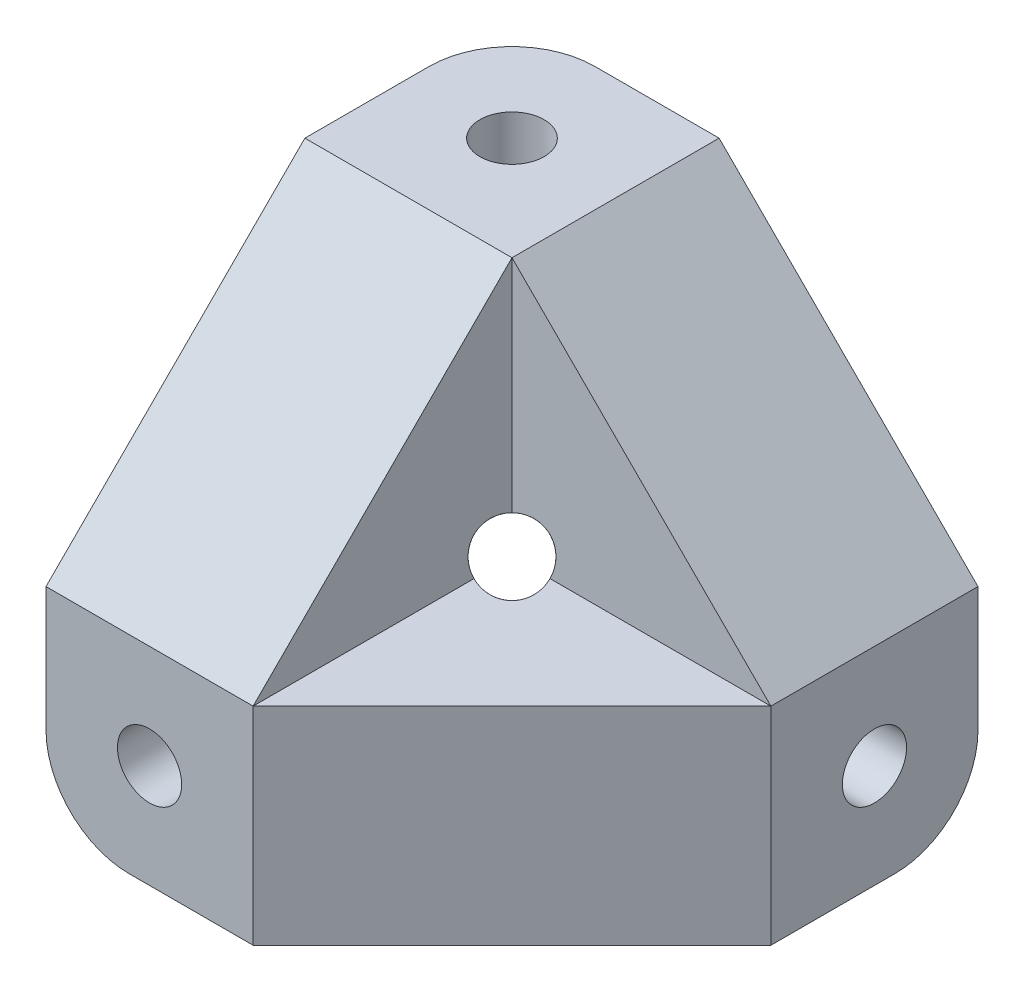
from build123d import *

# Parameters (mm, degrees)
ESBO_O1_W                        = 45
ESBO_O1_H                        = 45
RESSALTO_EXTRUS_O1_DEPTH         = 20
ESBO_O2_W                        = 25
ESBO_O2_H                        = 25
CORTE_EXTRUS_O1_DEPTH            = 70.705238631
ESBO_O3_W                        = 20
ESBO_O3_H                        = 20
RESSALTO_EXTRUS_O2_DEPTH         = 25
FURO_DE_DI_METRO_6_2_6_2_1_D     = 6.2
FURO_DE_DI_METRO_6_2_6_2_1_DEPTH = 35
FURO_DE_DI_METRO_6_2_6_2_2_D     = 6.2
FURO_DE_DI_METRO_6_2_6_2_2_DEPTH = 35
FURO_DE_DI_METRO_6_2_6_2_3_D     = 6.2
FURO_DE_DI_METRO_6_2_6_2_3_DEPTH = 35
FILETE2_R                        = 8
CHANFRO1_SIZE                    = 25
CHANFRO2_SIZE                    = 25
RESSALTO_EXTRUS_O3_DEPTH         = 20
ESBO_O12_R                       = 3
CORTE_EXTRUS_O2_DEPTH            = 71.906960985


# Some blends are built 0.0001 mm under size
with BuildPart() as part:
    # Esboço1 → Ressalto-extrusão1 (new body)
    with BuildSketch(Plane.XY.offset(20)):
        with Locations((-12.862035225, 34.142270059)):
            Rectangle(ESBO_O1_W, ESBO_O1_H)
    extrude(amount=-RESSALTO_EXTRUS_O1_DEPTH)

    # Esboço2 → Corte-extrusão1 (cut, through all)
    with BuildSketch(Plane(origin=(0, 0, 0), x_dir=(-1, 0, 0), z_dir=(0, 0, -1))):
        with Locations((2.862035225, 44.142270059)):
            Rectangle(ESBO_O2_W, ESBO_O2_H)
    extrude(amount=-CORTE_EXTRUS_O1_DEPTH, mode=Mode.SUBTRACT)

    # Esboço3 → Ressalto-extrusão2 (add)
    with BuildSketch(Plane.XY.offset(20)):
        with Locations((-25.362035225, 21.642270059)):
            Rectangle(ESBO_O3_W, ESBO_O3_H)
    extrude(amount=RESSALTO_EXTRUS_O2_DEPTH)

    # Furo de diâmetro Ø6.2 (6.2)1
    with Locations(Plane(origin=(9.637964775, 0, 0), x_dir=(0, 0, -1), z_dir=(1, 0, 0))):
        with Locations((-10, 21.642270059)):
            Hole(FURO_DE_DI_METRO_6_2_6_2_1_D / 2, depth=FURO_DE_DI_METRO_6_2_6_2_1_DEPTH)

    # Furo de diâmetro Ø6.2 (6.2)2
    with Locations(Plane(origin=(0, 56.642270059, 0), x_dir=(1, 0, 0), z_dir=(0, 1, 0))):
        with Locations((-25.362035225, -10)):
            Hole(FURO_DE_DI_METRO_6_2_6_2_2_D / 2, depth=FURO_DE_DI_METRO_6_2_6_2_2_DEPTH)

    # Furo de diâmetro Ø6.2 (6.2)3
    with Locations(Plane.XY.offset(45)):
        with Locations((-25.362035225, 21.642270059)):
            Hole(FURO_DE_DI_METRO_6_2_6_2_3_D / 2, depth=FURO_DE_DI_METRO_6_2_6_2_3_DEPTH)

    # Filete2
    filete2_edges = [part.edges().sort_by_distance(p)[0] for p in [
        (-35.362035225, 34.142270059, 0),
        (-12.862035225, 11.642270059, 0),
        (-35.362035225, 11.642270059, 22.5),
    ]]
    fillet(filete2_edges, radius=FILETE2_R)

    # Chanfro1
    # the kernel refuses this chamfer: 25 mm, written as the material it adds along each edge
    with BuildSketch(Plane(origin=(-35.362035225, 31.642270059, 20), x_dir=(0, -0.027495876610586317, 0.9996219169112966), z_dir=(1, 0, 0))) as chanfro1_piece_1_section:
        Polygon((CHANFRO1_SIZE * 0.999621916911, -CHANFRO1_SIZE * 0.0274958766106), (-CHANFRO1_SIZE * 0.0274958766106, -CHANFRO1_SIZE * 0.999621916911), (0, 0), align=None)
    chanfro1_piece_1 = extrude(amount=20, mode=Mode.PRIVATE)
    chanfro1_piece_1 = split(chanfro1_piece_1, bisect_by=Plane(origin=(-25.362035225, 39.873368248, 45), z_dir=(0, 0, -1)), keep=Keep.TOP, mode=Mode.PRIVATE)
    chanfro1_piece_1 = split(chanfro1_piece_1, bisect_by=Plane(origin=(-25.362035225, 56.642270059, 28.231098189), z_dir=(0, -1, 0)), keep=Keep.TOP, mode=Mode.PRIVATE)
    add(chanfro1_piece_1)

    # Chanfro2
    chanfro2_edges = [part.edges().sort_by_distance(p)[0] for p in [
        (-15.362035225, 31.642270059, 10),
    ]]
    chamfer(chanfro2_edges, length=CHANFRO2_SIZE - 0.0001)  # a hair under: the kernel refuses the full size

    # Esboço10 → Ressalto-extrusão3 (add)
    with BuildSketch(Plane.XZ.offset(-11.642270059)):
        Polygon((-15.362035225, 45), (9.637964775, 20), (-15.362035225, 20), align=None)
    extrude(amount=-RESSALTO_EXTRUS_O3_DEPTH)

    # Esboço12 → Corte-extrusão2 (cut, through all)
    with BuildSketch(Plane(origin=(20.426744945, 20.426744945, 20.426744945), x_dir=(-0.8164965809277259, 0.408248290463863, 0.4082482904638632), z_dir=(-0.577350269189626, -0.5773502691896256, -0.5773502691896258))):
        with Locations(Location((33.625917704, 8.232328107, 0), (0, 0, 120.000005232))):
            Circle(ESBO_O12_R)
    extrude(amount=CORTE_EXTRUS_O2_DEPTH, mode=Mode.SUBTRACT)


solid = part.part
